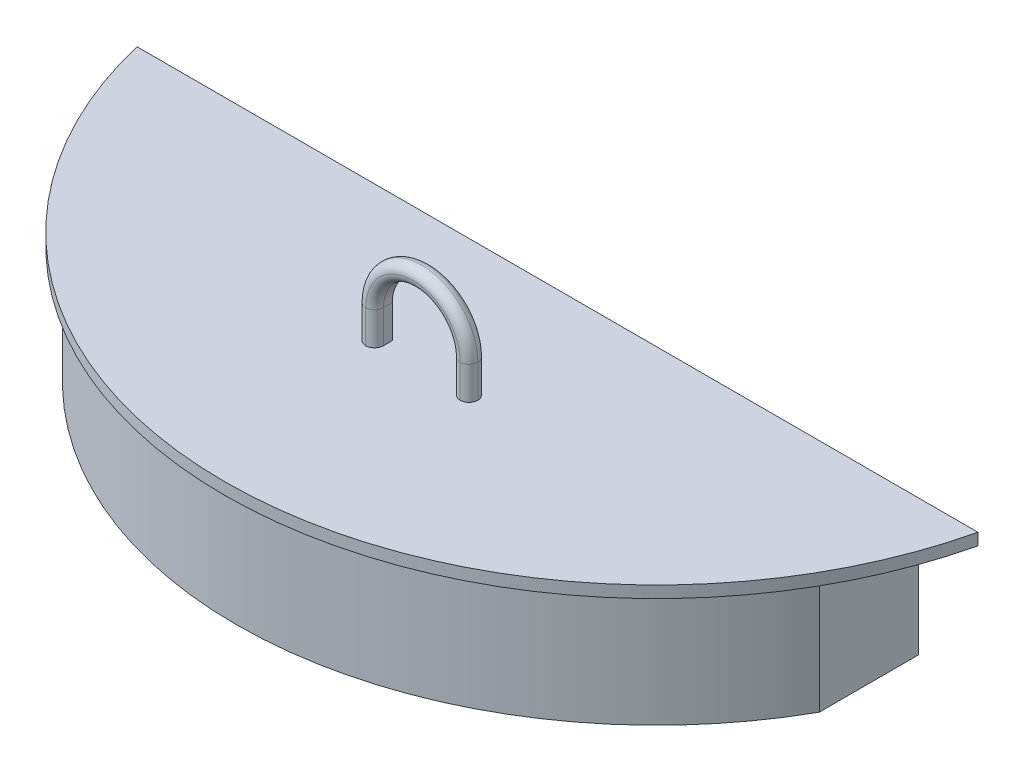
from build123d import *

# Parameters (mm, degrees)
BOSS_EXTRUDE1_DEPTH      = 20
BOSS_EXTRUDE1_2_DEPTH    = 20
SKETCH2_R                = 73.2
BOSS_EXTRUDE2_DEPTH      = 2
BODY_DELETE_KEEP_1_DEPTH = 22
BOSS_EXTRUDE3_DEPTH      = 1.5
BOSS_EXTRUDE3_DEPTH_BACK = 1.5
FILLET2_R                = 1.5


# Read off the part's stored shape, not the designer's step: Body-Delete/Keep 1
with BuildPart() as part:
    # Sketch1 → Boss-Extrude1 (new body)
    with BuildSketch(Plane(origin=(0, 0, 0), x_dir=(1, 0, 0), z_dir=(0, 1, 0))):
        with BuildLine():
            Line((62.2, -17.8), (-62.2, -17.8))
            Line((-62.2, -17.8), (-62.2, -34.649675323))
            ThreePointArc((-62.2, -34.649675323), (0, -71.2), (62.2, -34.649675323))
            Line((62.2, -34.649675323), (62.2, -17.8))
        make_face()
        with BuildLine():
            Line((60.2, -34.126236241), (60.2, -19.8))
            Line((60.2, -19.8), (-60.2, -19.8))
            Line((-60.2, -19.8), (-60.2, -34.126236241))
            ThreePointArc((-60.2, -34.126236241), (0, -69.2), (60.2, -34.126236241))
        make_face(mode=Mode.SUBTRACT)
    extrude(amount=BOSS_EXTRUDE1_DEPTH)

    # Sketch2 → Boss-Extrude2 (add)
    with BuildSketch(Plane(origin=(0, 20, 0), x_dir=(1, 0, 0), z_dir=(0, 1, 0))):
        with Locations(Location((0, 0, 0), (0, 0, 270))):
            Circle(SKETCH2_R)
    extrude(amount=BOSS_EXTRUDE2_DEPTH)


with BuildPart() as body_2:
    # Sketch1 → Boss-Extrude1 2 (new body)
    with BuildSketch(Plane(origin=(0, 0, 0), x_dir=(1, 0, 0), z_dir=(0, 1, 0))):
        with BuildLine():
            Line((-62.2, -15.8), (62.2, -15.8))
            Line((62.2, -15.8), (62.2, 34.649675323))
            ThreePointArc((62.2, 34.649675323), (0, 71.2), (-62.2, 34.649675323))
            Line((-62.2, 34.649675323), (-62.2, -15.8))
        make_face()
        with BuildLine():
            Line((-60.2, 34.126236241), (-60.2, -13.8))
            Line((-60.2, -13.8), (60.2, -13.8))
            Line((60.2, -13.8), (60.2, 34.126236241))
            ThreePointArc((60.2, 34.126236241), (0, 69.2), (-60.2, 34.126236241))
        make_face(mode=Mode.SUBTRACT)
    extrude(amount=BOSS_EXTRUDE1_2_DEPTH)


with BuildPart() as body_3:
    # Split1: the piece on the far side of the plane
    add(part.part)
    split(bisect_by=Plane(origin=(0, 0, 16.8), x_dir=(-1, 0, 0), z_dir=(0, 0, -1)), keep=Keep.BOTTOM)

    # Sketch4 → Boss-Extrude3 (add, two sides: drawn at the far end of the back side and taken through both)
    with BuildSketch(Plane.XY.offset(39.8).offset(-BOSS_EXTRUDE3_DEPTH_BACK)):
        with BuildLine():
            Line((-9.5, 15.435211288), (-9.5, 27.581262171))
            ThreePointArc((-9.5, 27.581262171), (0, 37.081262171), (9.5, 27.581262171))
            Line((9.5, 27.581262171), (9.5, 15.435211288))
            ThreePointArc((9.5, 15.435211288), (0, 5.935211288), (-9.5, 15.435211288))
        make_face()
        with BuildLine():
            ThreePointArc((-6.5, 15.435211288), (0, 8.935211288), (6.5, 15.435211288))
            Line((6.5, 15.435211288), (6.5, 27.581262171))
            ThreePointArc((6.5, 27.581262171), (0, 34.081262171), (-6.5, 27.581262171))
            Line((-6.5, 27.581262171), (-6.5, 15.435211288))
        make_face(mode=Mode.SUBTRACT)
    extrude(amount=BOSS_EXTRUDE3_DEPTH + BOSS_EXTRUDE3_DEPTH_BACK)

    # Fillet2
    fillet2_edges = [body_3.edges().sort_by_distance(p)[0] for p in [
        (-9.5, 17.717605644, 41.3),
        (0, 5.935211288, 41.3),
        (9.5, 17.717605644, 41.3),
        (-6.5, 17.717605644, 41.3),
        (0, 8.935211288, 41.3),
        (6.5, 17.717605644, 41.3),
        (9.5, 17.717605644, 38.3),
        (6.5, 17.717605644, 38.3),
        (0, 8.935211288, 38.3),
        (-6.5, 17.717605644, 38.3),
        (0, 5.935211288, 38.3),
        (-9.5, 17.717605644, 38.3),
        (9.5, 24.790631086, 38.3),
        (0, 37.081262171, 38.3),
        (-9.5, 24.790631086, 38.3),
        (-9.5, 24.790631086, 41.3),
        (9.5, 24.790631086, 41.3),
        (6.5, 24.790631086, 41.3),
        (-6.5, 24.790631086, 41.3),
        (0, 34.081262171, 41.3),
        (0, 37.081262171, 41.3),
    ]]
    fillet(fillet2_edges, radius=FILLET2_R - 0.0001)  # a hair under: the kernel refuses the full size


with BuildPart() as part_1:
    add(part.part)

    # Split1
    split(bisect_by=Plane(origin=(0, 0, 16.8), x_dir=(-1, 0, 0), z_dir=(0, 0, -1)), keep=Keep.TOP)


with BuildPart() as body_delete_keep_1_tool:
    # Body-Delete/Keep 1 outline → Body-Delete/Keep 1 (new body)
    with BuildSketch(Plane(origin=(0, 0, 0), x_dir=(1, 0, 0), z_dir=(0, 1, 0))):
        with BuildLine():
            ThreePointArc((71.246052522, -16.8), (0, 73.2), (-71.246052522, -16.8))
            Line((-71.246052522, -16.8), (71.246052522, -16.8))
        make_face()
    extrude(amount=BODY_DELETE_KEEP_1_DEPTH)


with BuildPart() as part_2:
    add(part_1.part)

    # Body-Delete/Keep 1: cut by body_delete_keep_1_tool
    add(body_delete_keep_1_tool.part, mode=Mode.SUBTRACT)


with BuildPart() as body_2_1:
    add(body_2.part)

    # Body-Delete/Keep 1: cut by body_delete_keep_1_tool
    add(body_delete_keep_1_tool.part, mode=Mode.SUBTRACT)


solid = body_3.part
